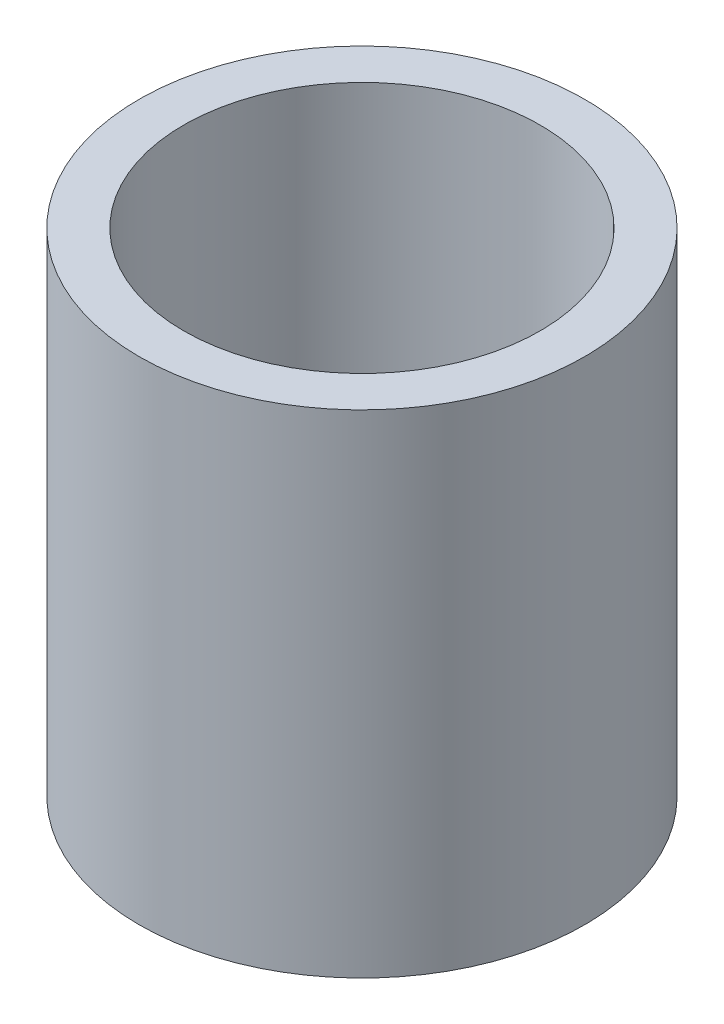
from build123d import *

# Parameters (mm, degrees)
SKETCH1_R           = 0.625
SKETCH1_R_2         = 0.5
BOSS_EXTRUDE1_DEPTH = 0.69


with BuildPart() as part:
    # Sketch1 → Boss-Extrude1 (new, symmetric)
    with BuildSketch(Plane(origin=(0, 0, 0), x_dir=(1, 0, 0), z_dir=(0, 1, 0))):
        Circle(SKETCH1_R)
        Circle(SKETCH1_R_2, mode=Mode.SUBTRACT)
    extrude(amount=BOSS_EXTRUDE1_DEPTH, both=True)


solid = part.part
